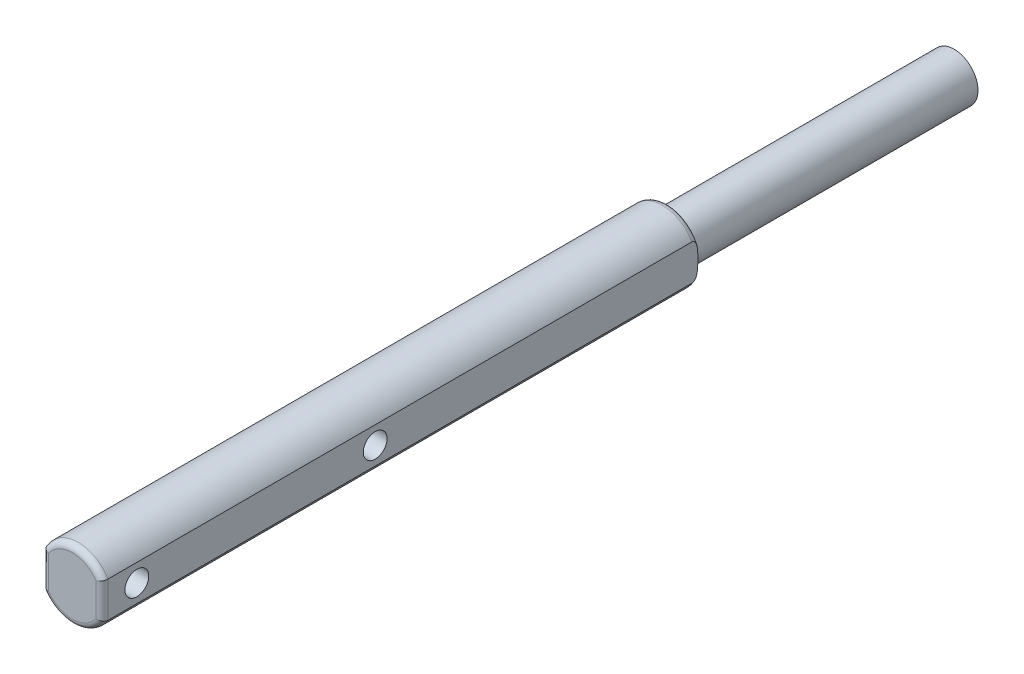
from build123d import *

# Parameters (mm, degrees)
ESQUISSE1_R             = 20
BOSS_EXTRU_1_DEPTH      = 500
ESQUISSE1_4_R           = 20
BOSS_EXTRU_2_DEPTH      = 240
ESQUISSE2_R             = 10
ENL_V_MAT_EXTRU_1_DEPTH = 504.338852067
CONG_1_R                = 5


with BuildPart() as part:
    # Esquisse1 → Boss.-Extru.1 (new body)
    # profile 1 of 2: a face of its own
    with BuildSketch(Plane.XY):
        with BuildLine():
            ThreePointArc((25, 15), (0, 29.154759474), (-25, 15))
            Line((-25, 15), (-25, -15))
            ThreePointArc((-25, -15), (0, -29.154759474), (25, -15))
            Line((25, -15), (25, 15))
        make_face()
        Circle(ESQUISSE1_R, mode=Mode.SUBTRACT)
    # profile 2 of 2: a face of its own
    with BuildSketch(Plane.XY):
        Circle(ESQUISSE1_R)
    extrude(amount=BOSS_EXTRU_1_DEPTH)

    # Esquisse1<4> → Boss.-Extru.2 (add)
    with BuildSketch(Plane.XY):
        Circle(ESQUISSE1_4_R)
    extrude(amount=-BOSS_EXTRU_2_DEPTH)

    # Esquisse2 → Enlèv. mat.-Extru.1 (cut, through all)
    with BuildSketch(Plane.ZY.offset(25)):
        with Locations((470.845240526, 0)):
            Circle(ESQUISSE2_R)
        with Locations((270.845240526, 0)):
            Circle(ESQUISSE2_R)
    extrude(amount=-ENL_V_MAT_EXTRU_1_DEPTH, mode=Mode.SUBTRACT)

    # Congé1
    # the kernel refuses this fillet: 5 mm, written as the material it takes off along each edge
    with BuildSketch(Plane(origin=(0, 0, 500), x_dir=(0.8826697936069986, -0.46999365469522936, 0), z_dir=(-0.46999365469522936, -0.8826697936069986, 0))) as cong_1_piece_1:
        with BuildLine():
            CenterArc((29.154759474 - CONG_1_R, -CONG_1_R), CONG_1_R, 0, 90)
            Line((29.154759474, -CONG_1_R), (29.154759474 + CONG_1_R * 0.02, -CONG_1_R))
            Line((29.154759474 + CONG_1_R * 0.02, -CONG_1_R), (29.154759474 + CONG_1_R * 0.02, CONG_1_R * 0.02))
            Line((29.154759474 + CONG_1_R * 0.02, CONG_1_R * 0.02), (29.154759474 - CONG_1_R, CONG_1_R * 0.02))
            Line((29.154759474 - CONG_1_R, CONG_1_R * 0.02), (29.154759474 - CONG_1_R, 0))
        make_face()
    revolve(axis=Axis((0, 0, 500), (0, 0, 1)), revolution_arc=236.067769297, mode=Mode.SUBTRACT)
    with BuildSketch(Plane(origin=(0, 0, 500), x_dir=(-0.8826697936069986, 0.4699936546952294, 0), z_dir=(0.4699936546952294, 0.8826697936069986, 0))) as cong_1_piece_2:
        with BuildLine():
            CenterArc((29.154759474 - CONG_1_R, -CONG_1_R), CONG_1_R, 0, 90)
            Line((29.154759474 - CONG_1_R, 0), (29.154759474 - CONG_1_R, CONG_1_R * 0.02))
            Line((29.154759474 - CONG_1_R, CONG_1_R * 0.02), (29.154759474 + CONG_1_R * 0.02, CONG_1_R * 0.02))
            Line((29.154759474 + CONG_1_R * 0.02, CONG_1_R * 0.02), (29.154759474 + CONG_1_R * 0.02, -CONG_1_R))
            Line((29.154759474 + CONG_1_R * 0.02, -CONG_1_R), (29.154759474, -CONG_1_R))
        make_face()
    revolve(axis=Axis((0, 0, 500), (0, 0, 1)), revolution_arc=236.067769297, mode=Mode.SUBTRACT)
    with BuildSketch(Plane(origin=(-25, 45, 500), x_dir=(0, 0, -1), z_dir=(0, -1, 0)), Plane(origin=(25, -45, 500), x_dir=(0, 0, -1), z_dir=(0, 1, 0))) as cong_1_piece_3:
        with BuildLine():
            CenterArc((CONG_1_R, CONG_1_R), CONG_1_R, 180, 90)
            Line((0, CONG_1_R), (-CONG_1_R * 0.02, CONG_1_R))
            Line((-CONG_1_R * 0.02, CONG_1_R), (-CONG_1_R * 0.02, -CONG_1_R * 0.02))
            Line((-CONG_1_R * 0.02, -CONG_1_R * 0.02), (CONG_1_R, -CONG_1_R * 0.02))
            Line((CONG_1_R, -CONG_1_R * 0.02), (CONG_1_R, 0))
        make_face()
    extrude(amount=90, mode=Mode.SUBTRACT)
    with BuildSketch(Plane(origin=(0, 0, 0), x_dir=(-0.8826697936069986, 0.4699936546952294, 0), z_dir=(0.4699936546952294, 0.8826697936069986, 0))) as cong_1_piece_4:
        with BuildLine():
            CenterArc((29.154759474 - CONG_1_R, CONG_1_R), CONG_1_R, 270, 90)
            Line((29.154759474 - CONG_1_R, 0), (29.154759474 - CONG_1_R, -CONG_1_R * 0.02))
            Line((29.154759474 - CONG_1_R, -CONG_1_R * 0.02), (29.154759474 + CONG_1_R * 0.02, -CONG_1_R * 0.02))
            Line((29.154759474 + CONG_1_R * 0.02, -CONG_1_R * 0.02), (29.154759474 + CONG_1_R * 0.02, CONG_1_R))
            Line((29.154759474 + CONG_1_R * 0.02, CONG_1_R), (29.154759474, CONG_1_R))
        make_face()
    revolve(axis=Axis((0, 0, 0), (0, 0, 1)), revolution_arc=236.067769297, mode=Mode.SUBTRACT)
    with BuildSketch(Plane(origin=(0, 0, 0), x_dir=(0.8826697936069986, -0.46999365469522936, 0), z_dir=(-0.46999365469522936, -0.8826697936069986, 0))) as cong_1_piece_5:
        with BuildLine():
            CenterArc((29.154759474 - CONG_1_R, CONG_1_R), CONG_1_R, 270, 90)
            Line((29.154759474, CONG_1_R), (29.154759474 + CONG_1_R * 0.02, CONG_1_R))
            Line((29.154759474 + CONG_1_R * 0.02, CONG_1_R), (29.154759474 + CONG_1_R * 0.02, -CONG_1_R * 0.02))
            Line((29.154759474 + CONG_1_R * 0.02, -CONG_1_R * 0.02), (29.154759474 - CONG_1_R, -CONG_1_R * 0.02))
            Line((29.154759474 - CONG_1_R, -CONG_1_R * 0.02), (29.154759474 - CONG_1_R, 0))
        make_face()
    revolve(axis=Axis((0, 0, 0), (0, 0, 1)), revolution_arc=236.067769297, mode=Mode.SUBTRACT)


solid = part.part
